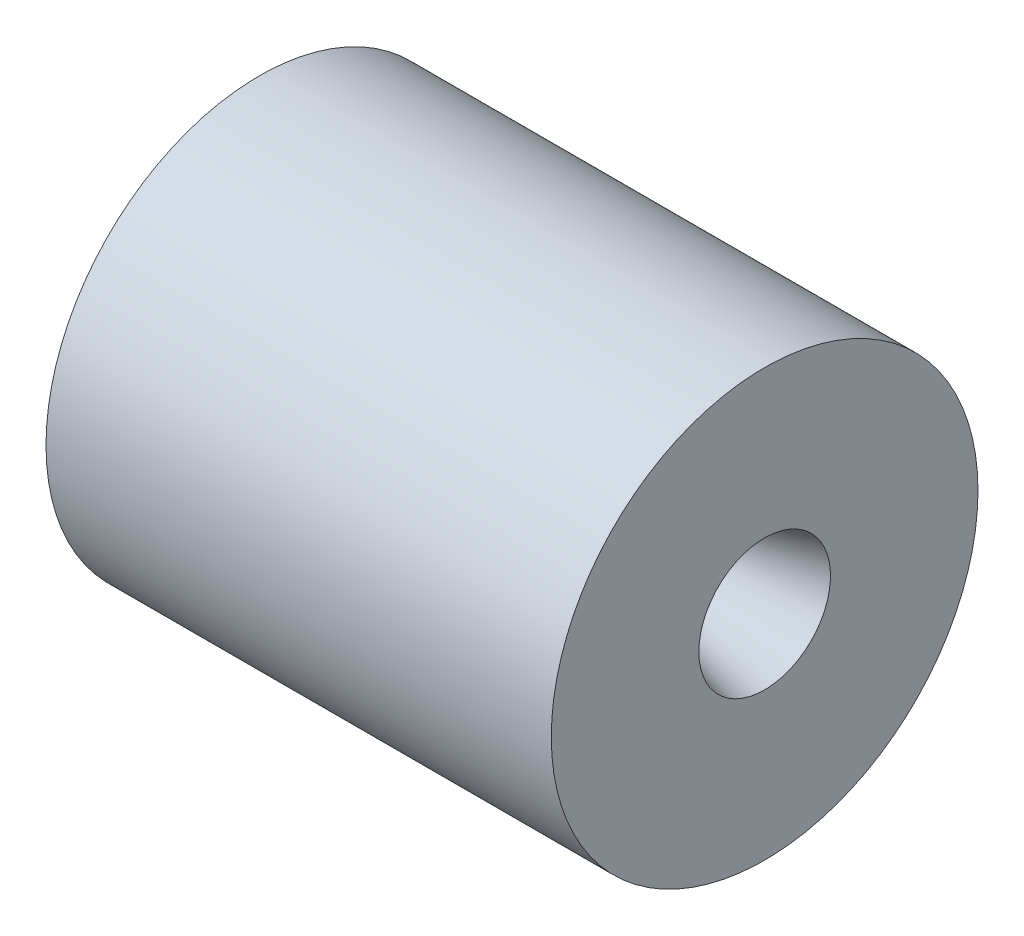
from build123d import *

# Parameters (mm, degrees)
SKETCH3_R          = 6.35
CUT_EXTRUDE2_DEPTH = 25.4


with BuildPart() as part:
    # chamberNozzle → Revolve1 (revolve)
    with BuildSketch(Plane.XY):
        with BuildLine():
            Line((0, 45.72), (0, 38.1))
            Line((0, 38.1), (110.897045256, 38.1))
            ThreePointArc((110.897045256, 38.1), (114.184047129, 37.667257994), (117.247045256, 36.398522628))
            Line((117.247045256, 36.398522628), (153.648338424, 15.382226219))
            ThreePointArc((153.648338424, 15.382226219), (157.542961832, 14.060179716), (161.647049978, 14.329175865))
            Line((161.647049978, 14.329175865), (210.545228126, 27.431403211))
            Line((210.545228126, 27.431403211), (210.545228126, 88.9))
            Line((210.545228126, 88.9), (0, 88.9))
            Line((0, 88.9), (0, 55.88))
            Line((0, 55.88), (5.08, 55.88))
            Line((5.08, 55.88), (5.08, 45.72))
            Line((5.08, 45.72), (0, 45.72))
        make_face()
    revolve(axis=Axis((0, 0, 0), (1, 0, 0)))

    # Sketch3 → Cut-Extrude2 (cut)
    with BuildSketch(Plane.ZY):
        with Locations((-69.85, 0)):
            Circle(SKETCH3_R)
        with Locations((-21.584837057, 66.431297663)):
            Circle(SKETCH3_R)
        with Locations((56.509837057, 41.056799873)):
            Circle(SKETCH3_R)
        with Locations((56.509837057, -41.056799873)):
            Circle(SKETCH3_R)
        with Locations((-21.584837057, -66.431297663)):
            Circle(SKETCH3_R)
    extrude(amount=-CUT_EXTRUDE2_DEPTH, mode=Mode.SUBTRACT)


solid = part.part
